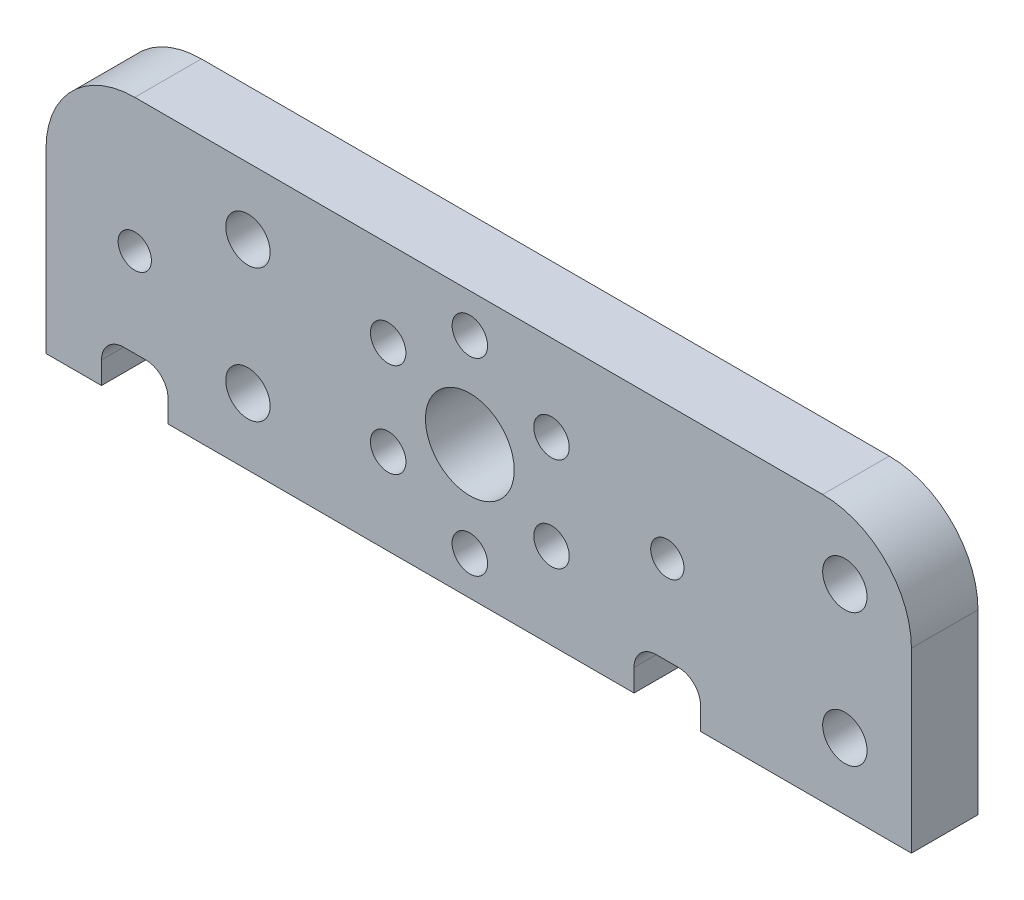
from build123d import *

# Parameters (mm, degrees)
SKETCH1_R           = 1
SKETCH1_R_2         = 0.75
SKETCH1_R_3         = 2
BOSS_EXTRUDE1_DEPTH = 3
SKETCH3_R           = 0.8
CUT_EXTRUDE1_DEPTH  = 3
CIRPATTERN1_COUNT   = 6


with BuildPart() as part:
    # Sketch1 → Boss-Extrude1 (new body)
    with BuildSketch(Plane.XY):
        with BuildLine():
            Line((-23.1, 2), (-23.1, -6))
            Line((-23.1, -6), (-20.6, -6))
            Line((-20.6, -6), (-20.6, -5))
            ThreePointArc((-20.6, -5), (-20.307106781, -4.292893219), (-19.6, -4))
            Line((-19.6, -4), (-18.6, -4))
            ThreePointArc((-18.6, -4), (-17.892893219, -4.292893219), (-17.6, -5))
            Line((-17.6, -5), (-17.6, -6))
            Line((-17.6, -6), (3.4, -6))
            Line((3.4, -6), (3.4, -5))
            ThreePointArc((3.4, -5), (3.692893219, -4.292893219), (4.4, -4))
            Line((4.4, -4), (5.4, -4))
            ThreePointArc((5.4, -4), (6.107106781, -4.292893219), (6.4, -5))
            Line((6.4, -5), (6.4, -6))
            Line((6.4, -6), (15.9, -6))
            Line((15.9, -6), (15.9, 2))
            ThreePointArc((15.9, 2), (14.728427125, 4.828427125), (11.9, 6))
            Line((11.9, 6), (-19.1, 6))
            ThreePointArc((-19.1, 6), (-21.928427125, 4.828427125), (-23.1, 2))
        make_face()
        with Locations((-14, -3)):
            Circle(SKETCH1_R, mode=Mode.SUBTRACT)
        with Locations((12.9, -3)):
            Circle(SKETCH1_R, mode=Mode.SUBTRACT)
        with Locations((-19.1, 0)):
            Circle(SKETCH1_R_2, mode=Mode.SUBTRACT)
        with Locations((-14, 3)):
            Circle(SKETCH1_R, mode=Mode.SUBTRACT)
        with Locations((-4, 0)):
            Circle(SKETCH1_R_3, mode=Mode.SUBTRACT)
        with Locations((4.9, 0)):
            Circle(SKETCH1_R_2, mode=Mode.SUBTRACT)
        with Locations((12.9, 3)):
            Circle(SKETCH1_R, mode=Mode.SUBTRACT)
    extrude(amount=BOSS_EXTRUDE1_DEPTH)

    # Sketch3 → Cut-Extrude1 (cut)
    with BuildSketch(Plane.XY.offset(3)):
        with Locations((-4, 4.25)):
            Circle(SKETCH3_R)
    cut_extrude1 = extrude(amount=-CUT_EXTRUDE1_DEPTH, mode=Mode.SUBTRACT)

    # CirPattern1: Cut-Extrude1 ×6 about axis
    cirpattern1_axis = Axis((-4, 0, 3), (0, 0, 1))
    for i in range(1, CIRPATTERN1_COUNT):
        add(cut_extrude1.rotate(cirpattern1_axis, i * 360 / CIRPATTERN1_COUNT), mode=Mode.SUBTRACT)


solid = part.part
